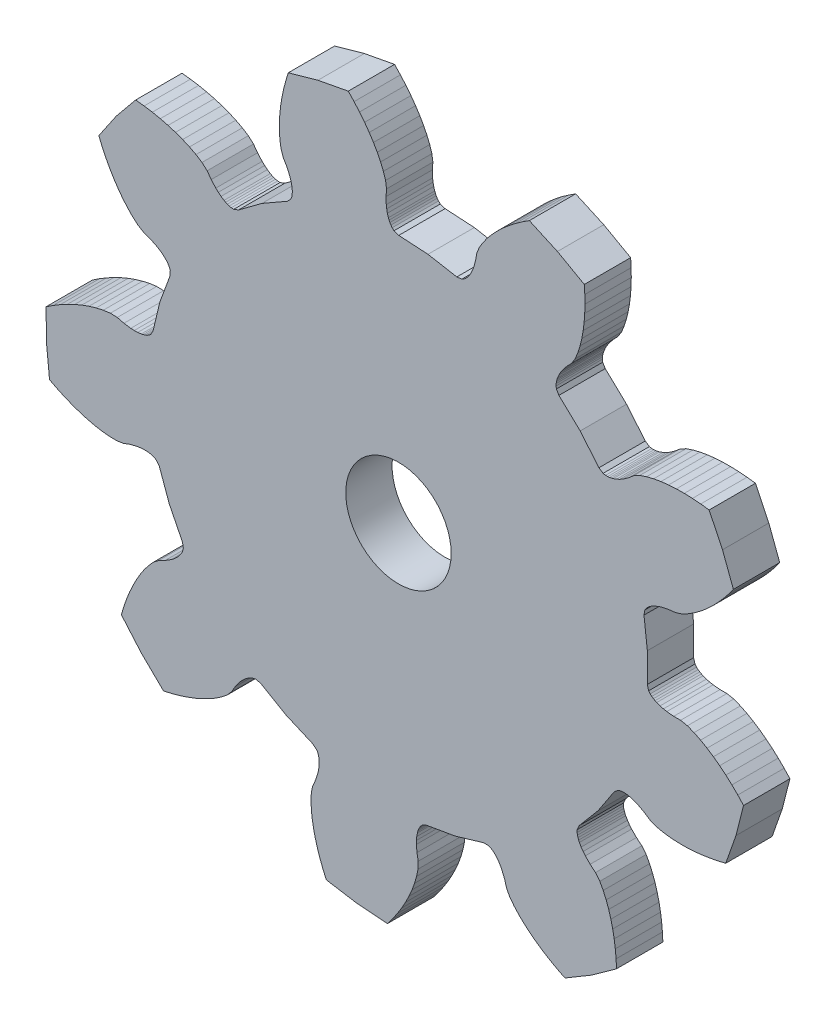
from build123d import *

# Parameters (mm, degrees)
SKETCH2_R           = 5.7785
BOSS_EXTRUDE2_DEPTH = 5.08


with BuildPart() as part:
    # Sketch2 → Boss-Extrude2 (new body)
    with BuildSketch(Plane.XY):
        Polygon((-34.274162162, -4.341986068), (-34.596488162, -3.900026068), (-34.829660162, -3.761850068), (-35.047084162, -3.677776068), (-35.256126162, -3.623674068), (-35.459834162, -3.589892068), (-35.659224162, -3.571350068), (-36.048860162, -3.568556068), (-36.429606162, -3.601576068), (-36.803240162, -3.662790068), (-37.533998162, -3.852274068), (-38.246722162, -4.115418068), (-38.996784162, -4.226670068), (-39.778342162, -4.207112068), (-40.574124162, -4.121514068), (-41.380320162, -3.979274068), (-42.194644162, -3.785218068), (-43.014810162, -3.542394068), (-43.839040162, -3.253088068), (-44.666064162, -2.918570068), (-45.493850162, -2.540110068), (-46.321382162, -2.118470068), (-46.657424162, 1.244743932), (-46.698318162, 4.624213932), (-45.923110162, 5.135515932), (-45.142568162, 5.603891932), (-44.357962162, 6.028579932), (-43.571070162, 6.408055932), (-42.783162162, 6.740541932), (-41.995508162, 7.024259932), (-41.210140162, 7.255399932), (-40.429090162, 7.429135932), (-39.654390162, 7.535815932), (-38.896454162, 7.508891932), (-38.159092162, 7.326773932), (-37.411824162, 7.219839932), (-37.033618162, 7.200789932), (-36.651602162, 7.210441932), (-36.264506162, 7.256415932), (-36.068418162, 7.297309932), (-35.870044162, 7.353443932), (-35.668114162, 7.430659932), (-35.461358162, 7.538355932), (-35.245204162, 7.701677932), (-34.974186162, 8.176911932), (-34.227934162, 11.301365932), (-33.120494162, 14.316599932), (-33.083156162, 14.862445932), (-33.172818162, 15.117969932), (-33.285594162, 15.322185932), (-33.411070162, 15.497953932), (-33.545182162, 15.654671932), (-33.685898162, 15.797165932), (-33.982824162, 16.049895932), (-34.295752162, 16.269097932), (-34.621126162, 16.462645932), (-35.302862162, 16.787257932), (-36.017872162, 17.043543932), (-36.664048162, 17.440545932), (-37.250280162, 17.957943932), (-37.804762162, 18.535031932), (-38.330796162, 19.162157932), (-38.829906162, 19.834241932), (-39.302092162, 20.547473932), (-39.747608162, 21.299059932), (-40.166200162, 22.086713932), (-40.557106162, 22.908911932), (-40.919818162, 23.763621932), (-39.015326162, 26.555843932), (-36.874360162, 29.171027932), (-35.952086162, 29.064601932), (-35.052926162, 28.921599932), (-34.179166162, 28.742529932), (-33.332330162, 28.527391932), (-32.514958162, 28.275677932), (-31.729336162, 27.986879932), (-30.979020162, 27.659219932), (-30.268836162, 27.290157932), (-29.606912162, 26.873851932), (-29.043794162, 26.366105932), (-28.595992162, 25.752441932), (-28.092056162, 25.190339932), (-27.814688162, 24.932529932), (-27.515730162, 24.694531932), (-27.189848162, 24.480917932), (-27.013318162, 24.385921932), (-26.825104162, 24.301593932), (-26.620888162, 24.230981932), (-26.393304162, 24.180435932), (-26.122794162, 24.166719932), (-25.609714162, 24.356457932), (-23.029836162, 26.270347932), (-20.243202162, 27.868261932), (-19.863726162, 28.262469932), (-19.768222162, 28.515961932), (-19.723264162, 28.744815932), (-19.706246162, 28.959953932), (-19.708278162, 29.166455932), (-19.724534162, 29.366099932), (-19.789812162, 29.750401932), (-19.888364162, 30.119463932), (-20.013332162, 30.476841932), (-20.326768162, 31.163657932), (-20.709800162, 31.819739932), (-20.949576162, 32.539067932), (-21.066162162, 33.312243932), (-21.120010162, 34.110819932), (-21.119756162, 34.929461932), (-21.070226162, 35.764867932), (-20.973452162, 36.614751932), (-20.831720162, 37.476827932), (-20.645792162, 38.349317932), (-20.416938162, 39.230443932), (-20.145158162, 40.118427932), (-16.891672162, 41.033335932), (-13.570622162, 41.660461932), (-12.932320162, 40.985837932), (-12.335420162, 40.298513932), (-11.781192162, 39.599759932), (-11.270906162, 38.890591932), (-10.806340162, 38.172279932), (-10.390288162, 37.446093932), (-10.026306162, 36.712795932), (-9.719474162, 35.973655932), (-9.479952162, 35.229181932), (-9.374796162, 34.478103932), (-9.426104162, 33.720421932), (-9.401720162, 32.965787932), (-9.354730162, 32.590121932), (-9.279038162, 32.215471932), (-9.166516162, 31.842345932), (-9.092348162, 31.656417932), (-9.002432162, 31.470489932), (-8.891434162, 31.285323932), (-8.749448162, 31.100411932), (-8.551074162, 30.915753932), (-8.035962162, 30.731349932), (-4.829466162, 30.539071932), (-1.667674162, 29.971889932), (-1.123606162, 30.030055932), (-0.887386162, 30.162897932), (-0.706030162, 30.309201932), (-0.554646162, 30.463379932), (-0.423582162, 30.622637932), (-0.307758162, 30.785959932), (-0.110654162, 31.122255932), (0.051143838, 31.468457932), (0.185255838, 31.822533932), (0.386423838, 32.550243932), (0.514693838, 33.299035932), (0.793585838, 34.004139932), (1.201255838, 34.671397932), (1.673187838, 35.317573932), (2.199475838, 35.944699932), (2.774785838, 36.552775932), (3.395053838, 37.141801932), (4.057739838, 37.711015932), (4.761065838, 38.259909932), (5.502745838, 38.787721932), (6.281509838, 39.293181932), (9.362021838, 37.902785932), (12.309437838, 36.248483932), (12.364555838, 35.321383932), (12.380049838, 34.411301932), (12.355411838, 33.519507932), (12.290641838, 32.648287932), (12.184723838, 31.799673932), (12.036387838, 30.975697932), (11.844109838, 30.179915932), (11.603825838, 29.416645932), (11.308931838, 28.692491932), (10.906595838, 28.049617932), (10.380307838, 27.501993932), (9.913963838, 26.908395932), (9.708477838, 26.590387932), (9.525851838, 26.254599932), (9.372181838, 25.896459932), (9.309443838, 25.706213932), (9.258897838, 25.506061932), (9.224607838, 25.292955932), (9.214701838, 25.060037932), (9.247975838, 24.791051932), (9.523819838, 24.318611932), (11.856809838, 22.110335932), (13.914209838, 19.643487932), (14.368361838, 19.338433932), (14.634553838, 19.288141932), (14.867725838, 19.283823932), (15.082609838, 19.304397932), (15.285555838, 19.342243932), (15.479357838, 19.393043932), (15.846387838, 19.523853932), (16.192843838, 19.685143932), (16.523297838, 19.870309932), (17.145089838, 20.298299932), (17.724463838, 20.789281932), (18.391467838, 21.150215932), (19.132639838, 21.399389932), (19.909625838, 21.590905932), (20.715821838, 21.733145932), (21.547417838, 21.829157932), (22.401111838, 21.881735932), (23.274871838, 21.891641932), (24.166157838, 21.860145932), (25.073699838, 21.787755932), (25.995465838, 21.674471932), (27.461299838, 18.629011932), (28.655607838, 15.467219932), (28.102141838, 14.721729932), (27.528863838, 14.014593932), (26.936789838, 13.347335932), (26.327189838, 12.721479932), (25.700317838, 12.139565932), (25.057443838, 11.603625932), (24.398567838, 11.117723932), (23.723943838, 10.687193932), (23.032301838, 10.322195932), (22.310941838, 10.088261932), (21.555799838, 10.007235932), (20.816913838, 9.852041932), (20.455217838, 9.740535932), (20.099363838, 9.600835932), (19.751383838, 9.425321932), (19.581203838, 9.319911932), (19.413817838, 9.199007932), (19.250495838, 9.057529932), (19.093015838, 8.885825932), (18.945949838, 8.658241932), (18.853493838, 8.118999932), (19.221031838, 4.927743932), (19.211633838, 1.715659932), (19.363271838, 1.190133932), (19.535229838, 0.980329932), (19.710743838, 0.827167932), (19.888797838, 0.704739932), (20.068375838, 0.603393932), (20.249477838, 0.517541932), (20.614983838, 0.381905932), (20.983791838, 0.282591932), (21.355901838, 0.212233932), (22.107487838, 0.140351932), (22.866947838, 0.144161932), (23.609897838, -0.007984068), (24.337861838, -0.293734068), (25.056173838, -0.646286068), (25.765087838, -1.055734068), (26.463841838, -1.516490068), (27.151673838, -2.025252068), (27.827313838, -2.578972068), (28.489999838, -3.176126068), (29.138461838, -3.814936068), (29.771683838, -4.494386068), (28.937293838, -7.769462068), (27.819947838, -10.959194068), (26.916469838, -11.174586068), (26.022897838, -11.347814068), (25.140501838, -11.478370068), (24.271059838, -11.565746068), (23.416857838, -11.608926068), (22.579927838, -11.606132068), (21.762809838, -11.554824068), (20.969313838, -11.450684068), (20.205027838, -11.286092068), (19.501955838, -11.001612068), (18.871273838, -10.578194068), (18.205539838, -10.222086068), (17.856797838, -10.075020068), (17.494593838, -9.953354068), (17.115117838, -9.864200068), (16.916743838, -9.835244068), (16.711003838, -9.820512068), (16.495103838, -9.823814068), (16.263963838, -9.854294068), (16.004883838, -9.933796068), (15.587561838, -10.287618068), (13.817943838, -12.968334068), (11.745811838, -15.422990068), (11.524323838, -15.923370068), (11.521021838, -16.194134068), (11.557089838, -16.424512068), (11.614747838, -16.632792068), (11.687137838, -16.825832068), (11.770957838, -17.007950068), (11.963489838, -17.346786068), (12.182437838, -17.659968068), (12.422213838, -17.953084068), (12.951549838, -18.491056068), (13.535749838, -18.976704068), (14.007173838, -19.570556068), (14.381061838, -20.257372068), (14.704911838, -20.989146068), (14.984819838, -21.758512068), (15.223833838, -22.560644068), (15.423731838, -23.392494068), (15.585275838, -24.251014068), (15.708973838, -25.134426068), (15.795079838, -26.040698068), (15.843593838, -26.968052068), (13.099123838, -28.940616068), (10.192855838, -30.665784068), (9.362529838, -30.249986068), (8.566493838, -29.808280068), (7.806525838, -29.341174068), (7.084657838, -28.849430068), (6.402413838, -28.333302068), (5.763095838, -27.793044068), (5.170259838, -27.228656068), (4.628985838, -26.638868068), (4.149433838, -26.021394068), (3.793833838, -25.351596068), (3.582759838, -24.621854068), (3.301835838, -23.921322068), (3.129115838, -23.584264068), (2.929725838, -23.258128068), (2.696299838, -22.945962068), (2.563203838, -22.796610068), (2.415121838, -22.652846068), (2.247481838, -22.516702068), (2.050885838, -22.391480068), (1.801203838, -22.285816068), (1.254087838, -22.288610068), (-1.824646162, -23.204788068), (-4.989740162, -23.753174068), (-5.480976162, -23.993966068), (-5.657760162, -24.199452068), (-5.778156162, -24.399096068), (-5.867818162, -24.595438068), (-5.936398162, -24.790002068), (-5.989484162, -24.983296068), (-6.059588162, -25.366582068), (-6.093116162, -25.747328068), (-6.097942162, -26.126042068), (-6.038252162, -26.878390068), (-5.902870162, -27.625912068), (-5.923444162, -28.383848068), (-6.078384162, -29.150420068), (-6.300888162, -29.919024068), (-6.581050162, -30.688390068), (-6.913536162, -31.456486068), (-7.295044162, -32.222042068), (-7.723034162, -32.983788068), (-8.196236162, -33.739946068), (-8.712618162, -34.489500068), (-9.271672162, -35.231180068), (-12.641998162, -34.978196068), (-15.977272162, -34.431588068), (-16.346080162, -33.579418068), (-16.671962162, -32.729280068), (-16.953902162, -31.882952068), (-17.190884162, -31.042212068), (-17.381638162, -30.208330068), (-17.524132162, -29.383592068), (-17.615572162, -28.570030068), (-17.650878162, -27.770438068), (-17.621414162, -26.989134068), (-17.463426162, -26.247454068), (-17.155832162, -25.552764068), (-16.920882162, -24.835468068), (-16.836554162, -24.466152068), (-16.779658162, -24.088454068), (-16.757814162, -23.699326068), (-16.763910162, -23.498920068), (-16.784738162, -23.293688068), (-16.825632162, -23.081598068), (-16.895736162, -22.859348068), (-17.019180162, -22.618048068), (-17.440058162, -22.268544068), (-20.387474162, -20.991178068), (-23.164456162, -19.376754068), (-23.695570162, -19.245436068), (-23.963032162, -19.289378068), (-24.183504162, -19.364816068), (-24.378576162, -19.457780068), (-24.556122162, -19.562682068), (-24.720968162, -19.676728068), (-25.021196162, -19.925394068), (-25.291706162, -20.195142068), (-25.538594162, -20.482162068), (-25.976490162, -21.097096068), (-26.353172162, -21.756734068), (-26.856346162, -22.324170068), (-27.467724162, -22.811596068), (-28.132442162, -23.257620068), (-28.841356162, -23.666814068), (-29.589894162, -24.041464068), (-30.374246162, -24.382840068), (-31.191618162, -24.690942068), (-32.040232162, -24.966278068), (-32.917548162, -25.208340068), (-33.822550162, -25.417128068), (-36.241646162, -23.056960068), (-38.445350162, -20.494354068), (-38.180174162, -19.604592068), (-37.883248162, -18.743786068), (-37.555334162, -17.914476068), (-37.196432162, -17.117932068), (-36.806542162, -16.356440068), (-36.385410162, -15.633048068), (-35.932528162, -14.951058068), (-35.445864162, -14.315804068), (-34.920846162, -13.736430068), (-34.323184162, -13.269832068), (-33.641194162, -12.935314068), (-32.999844162, -12.536788068), (-32.698092162, -12.308188068), (-32.411580162, -12.055458068), (-32.144626162, -11.771232068), (-32.020674162, -11.614006068), (-31.904596162, -11.443318068), (-31.799694162, -11.254596068), (-31.710540162, -11.039204068), (-31.649834162, -10.775044068), (-31.747624162, -10.236818068), (-33.184502162, -7.363824068), align=None)
        with Locations((-8.065426162, 3.402219932)):
            Circle(SKETCH2_R, mode=Mode.SUBTRACT)
    extrude(amount=BOSS_EXTRUDE2_DEPTH)


solid = part.part
